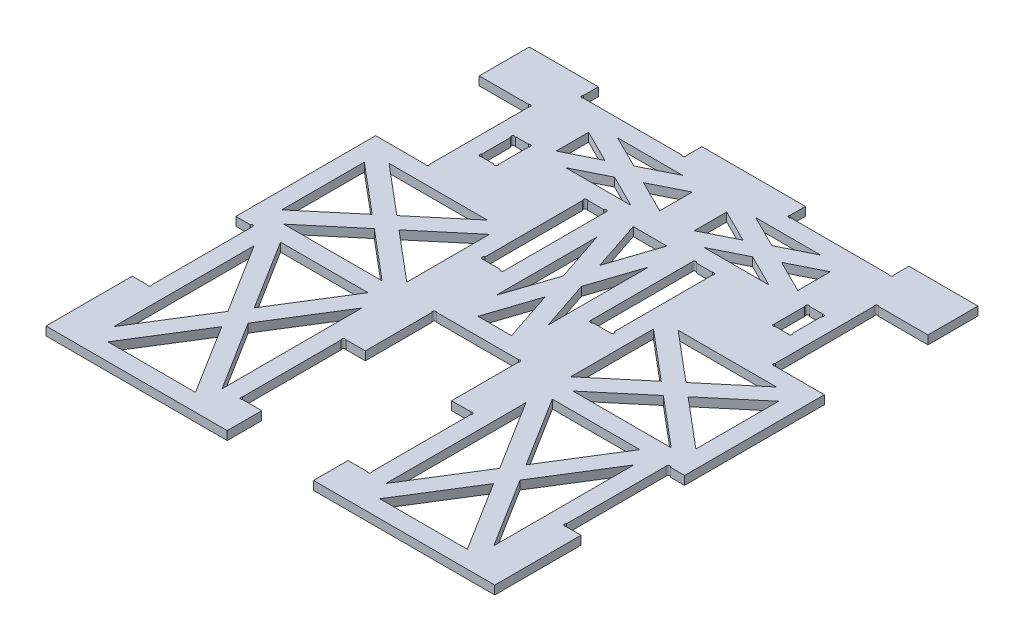
from build123d import *

# Parameters (mm, degrees)
SKETCH1_W           = 330.2
SKETCH1_H           = 355.6
BOSS_EXTRUDE1_DEPTH = 6.35
SKETCH2_W           = 63.5
SKETCH2_H           = 152.4
CUT_EXTRUDE1_DEPTH  = 243.716238641
SKETCH3_W           = 25.4
SKETCH3_H           = 76.2
SKETCH3_W_2         = 12.7
SKETCH3_H_2         = 25.4
CUT_EXTRUDE2_DEPTH  = 243.716238641
SKETCH4_W           = 12.7
SKETCH4_H           = 76.2
SKETCH4_W_2         = 76.2
SKETCH4_H_2         = 12.7
SKETCH4_W_3         = 15.875
CUT_EXTRUDE3_DEPTH  = 243.716238641
CUT_EXTRUDE4_DEPTH  = 243.716238641
SKETCH6_R           = 1.27
CUT_EXTRUDE5_DEPTH  = 243.716238641


with BuildPart() as part:
    # Sketch1 → Boss-Extrude1 (new body)
    with BuildSketch(Plane(origin=(0, 0, 0), x_dir=(1, 0, 0), z_dir=(0, 1, 0))):
        Rectangle(SKETCH1_W, SKETCH1_H)
    extrude(amount=BOSS_EXTRUDE1_DEPTH)

    # Sketch2 → Cut-Extrude1 (cut, through all)
    with BuildSketch(Plane(origin=(0, 6.35, 0), x_dir=(1, 0, 0), z_dir=(0, 1, 0))):
        with Locations((0, -101.6)):
            Rectangle(SKETCH2_W, SKETCH2_H)
    extrude(amount=-CUT_EXTRUDE1_DEPTH, mode=Mode.SUBTRACT)

    # Sketch3 → Cut-Extrude2 (cut, through all)
    with BuildSketch(Plane(origin=(0, 6.35, 0), x_dir=(1, 0, 0), z_dir=(0, 1, 0))):
        with Locations((139.7, 102.87)):
            Rectangle(SKETCH3_W, SKETCH3_H)
        with Locations((107.95, 102.87)):
            Rectangle(SKETCH3_W_2, SKETCH3_H_2)
        with Locations((-107.95, 102.87)):
            Rectangle(SKETCH3_W_2, SKETCH3_H_2)
        with Locations((-139.7, 102.87)):
            Rectangle(SKETCH3_W, SKETCH3_H)
    extrude(amount=-CUT_EXTRUDE2_DEPTH, mode=Mode.SUBTRACT)

    # Sketch4 → Cut-Extrude3 (cut, through all)
    with BuildSketch(Plane(origin=(0, 6.35, 0), x_dir=(1, 0, 0), z_dir=(0, 1, 0))):
        with Locations((-158.75, 102.87)):
            Rectangle(SKETCH4_W, SKETCH4_H)
        with Locations((-158.75, -76.2)):
            Rectangle(SKETCH4_W, SKETCH4_H)
        with Locations((158.75, 102.87)):
            Rectangle(SKETCH4_W, SKETCH4_H)
        with Locations((158.75, -76.2)):
            Rectangle(SKETCH4_W, SKETCH4_H)
        with Locations((76.2, 171.45)):
            Rectangle(SKETCH4_W_2, SKETCH4_H_2)
        with Locations((-76.2, 171.45)):
            Rectangle(SKETCH4_W_2, SKETCH4_H_2)
        with Locations((-39.6875, -114.3)):
            Rectangle(SKETCH4_W_3, SKETCH4_H)
        with Locations((39.6875, 63.5)):
            Rectangle(SKETCH4_W_3, SKETCH4_H)
        with Locations((-39.6875, 63.5)):
            Rectangle(SKETCH4_W_3, SKETCH4_H)
        with Locations((39.6875, -114.3)):
            Rectangle(SKETCH4_W_3, SKETCH4_H)
    extrude(amount=-CUT_EXTRUDE3_DEPTH, mode=Mode.SUBTRACT)

    # Sketch5 → Cut-Extrude4 (cut, through all)
    with BuildSketch(Plane(origin=(0, 6.35, 0), x_dir=(1, 0, 0), z_dir=(0, 1, 0))):
        Polygon((-100.0125, -113.581156038), (-132.211777476, -165.1), (-67.813222524, -165.1), align=None)
        Polygon((-139.7, -50.081156038), (-139.7, -153.118843962), (-107.500722524, -101.6), align=None)
        Polygon((-60.325, -50.081156038), (-92.524277476, -101.6), (-60.325, -153.118843962), align=None)
        Polygon((-132.211777476, -38.1), (-100.0125, -89.618843962), (-67.813222524, -38.1), align=None)
        Polygon((-106.3625, 5.036351334), (-142.536851996, -25.4), (-70.188148004, -25.4), align=None)
        Polygon((-152.4, 43.771351334), (-152.4, -17.101351334), (-116.225648004, 13.335), align=None)
        Polygon((-60.325, 43.771351334), (-96.499351996, 13.335), (-60.325, -17.101351334), align=None)
        Polygon((-142.536851996, 52.07), (-106.3625, 21.633648666), (-70.188148004, 52.07), align=None)
        Polygon((-50.8, 126.250484171), (-74.700968343, 114.3), (-26.899031657, 114.3), align=None)
        Polygon((-88.9, 145.300484171), (-88.9, 121.399515829), (-64.999031657, 133.35), align=None)
        Polygon((-12.7, 145.300484171), (-36.600968343, 133.35), (-12.7, 121.399515829), align=None)
        Polygon((-74.700968343, 152.4), (-50.8, 140.449515829), (-26.899031657, 152.4), align=None)
        Polygon((0, 24.369536858), (-12.356512286, -12.7), (12.356512286, -12.7), align=None)
        Polygon((-19.05, 81.519536858), (-19.05, 7.380463142), (-6.693487714, 44.45), align=None)
        Polygon((19.05, 81.519536858), (6.693487714, 44.45), (19.05, 7.380463142), align=None)
        Polygon((-12.356512286, 101.6), (0, 64.530463142), (12.356512286, 101.6), align=None)
    cut_extrude4 = extrude(amount=-CUT_EXTRUDE4_DEPTH, mode=Mode.SUBTRACT)

    # Mirror1: Cut-Extrude4 across plane
    add(cut_extrude4.mirror(Plane(origin=(0, 0, 0), x_dir=(0, 0, 1), z_dir=(1, 0, 0))), mode=Mode.SUBTRACT)

    # Sketch6 → Cut-Extrude5 (cut, through all)
    with BuildSketch(Plane(origin=(0, 6.35, 0), x_dir=(1, 0, 0), z_dir=(0, 1, 0))):
        with Locations((-127.819401443, 65.74029958)):
            Circle(SKETCH6_R)
        with Locations((-127.938300971, 140.114142951)):
            Circle(SKETCH6_R)
        with Locations((-113.390747669, 165.986656753)):
            Circle(SKETCH6_R)
        with Locations((-39.124010483, 165.851200727)):
            Circle(SKETCH6_R)
        with Locations((-46.842435984, 100.59975325)):
            Circle(SKETCH6_R)
        with Locations((-32.940336301, 101.157281704)):
            Circle(SKETCH6_R)
        with Locations((-47.298248414, 26.627246268)):
            Circle(SKETCH6_R)
        with Locations((-32.907949838, 25.921586207)):
            Circle(SKETCH6_R)
        with Locations((-153.566823076, -38.601421888)):
            Circle(SKETCH6_R)
        with Locations((-153.151740664, -113.276385828)):
            Circle(SKETCH6_R)
        with Locations((-46.766926853, -151.463725214)):
            Circle(SKETCH6_R)
        with Locations((-46.820773943, -77.182914264)):
            Circle(SKETCH6_R)
        with Locations((-30.885953067, -26.330764684)):
            Circle(SKETCH6_R)
        with Locations((-113.677974461, 114.462758279)):
            Circle(SKETCH6_R)
        with Locations((-102.514812329, 114.689080933)):
            Circle(SKETCH6_R)
        with Locations((-102.638073114, 90.901644865)):
            Circle(SKETCH6_R)
        with Locations((-113.565600374, 91.206126049)):
            Circle(SKETCH6_R)
    cut_extrude5 = extrude(amount=-CUT_EXTRUDE5_DEPTH, mode=Mode.SUBTRACT)

    # Mirror2: Cut-Extrude5 across plane
    add(cut_extrude5.mirror(Plane(origin=(0, 0, 0), x_dir=(0, 0, 1), z_dir=(1, 0, 0))), mode=Mode.SUBTRACT)


solid = part.part
